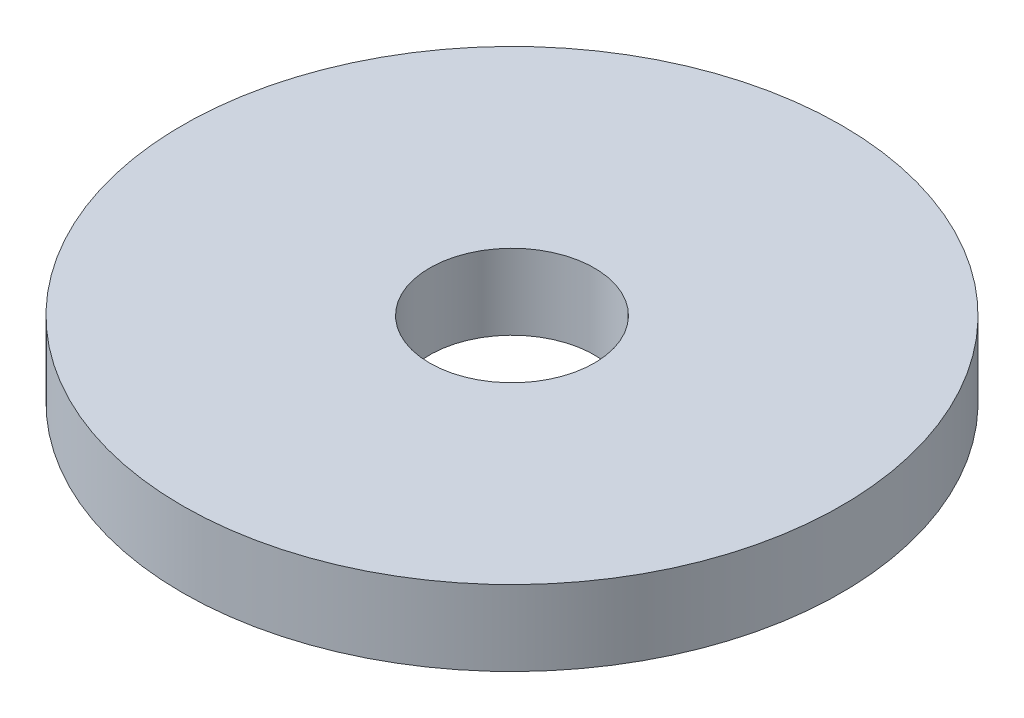
from build123d import *

# Parameters (mm, degrees)
SKETCH1_R           = 70
BOSS_EXTRUDE1_DEPTH = 16
SKETCH2_R           = 17.5
CUT_EXTRUDE1_DEPTH  = 101.279609094


with BuildPart() as part:
    # Sketch1 → Boss-Extrude1 (new body)
    with BuildSketch(Plane(origin=(0, 0, 0), x_dir=(1, 0, 0), z_dir=(0, 1, 0))):
        Circle(SKETCH1_R)
    extrude(amount=BOSS_EXTRUDE1_DEPTH)

    # Sketch2 → Cut-Extrude1 (cut, through all)
    with BuildSketch(Plane(origin=(0, 0, 0), x_dir=(1, 0, 0), z_dir=(0, 1, 0))):
        Circle(SKETCH2_R)
    extrude(amount=CUT_EXTRUDE1_DEPTH, mode=Mode.SUBTRACT)


solid = part.part
